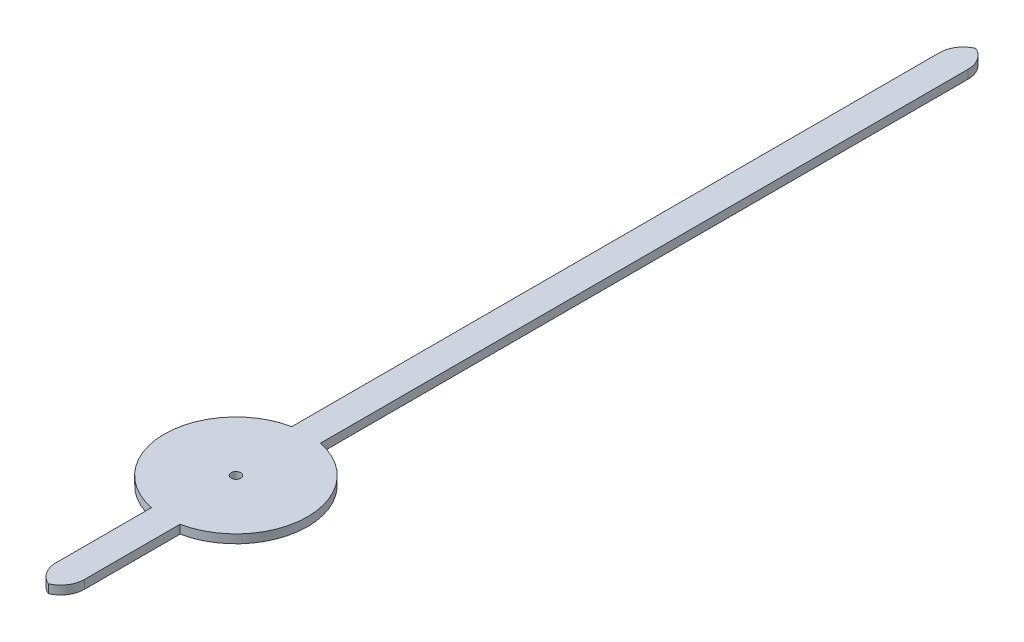
from build123d import *

# Parameters (mm, degrees)
SKETCH1_R           = 0.1
BOSS_EXTRUDE1_DEPTH = 0.18
FILLET2_R           = 0.5


with BuildPart() as part:
    # Sketch1 → Boss-Extrude1 (new body)
    with BuildSketch(Plane(origin=(0, 0, 0), x_dir=(1, 0, 0), z_dir=(0, 1, 0))):
        with BuildLine():
            Line((-0.3, -3.969693846), (-0.3, -1.469693846))
            ThreePointArc((-0.3, -1.469693846), (-1.5, 0), (-0.3, 1.469693846))
            Line((-0.3, 1.469693846), (-0.3, 15.530306154))
            Line((-0.3, 15.530306154), (0.3, 15.530306154))
            Line((0.3, 15.530306154), (0.3, 1.469693846))
            ThreePointArc((0.3, 1.469693846), (1.5, 0), (0.3, -1.469693846))
            Line((0.3, -1.469693846), (0.3, -3.969693846))
            Line((0.3, -3.969693846), (-0.3, -3.969693846))
        make_face()
        with Locations(Location((0, 0, 0), (0, 0, 270))):
            Circle(SKETCH1_R, mode=Mode.SUBTRACT)
    extrude(amount=BOSS_EXTRUDE1_DEPTH)

    # Fillet2
    # the kernel refuses this fillet: 0.5 mm, written as the material it takes off along each edge
    with BuildSketch(Plane(origin=(-0.3, -1.25, -15.530306154), x_dir=(0, 0, 1), z_dir=(0, 1, 0)), Plane(origin=(0.3, -1.25, -15.530306154), x_dir=(-1, 0, 0), z_dir=(0, 1, 0)), Plane(origin=(-0.3, -1.25, 3.969693846), x_dir=(1, 0, 0), z_dir=(0, 1, 0)), Plane(origin=(0.3, -1.25, 3.969693846), x_dir=(0, 0, -1), z_dir=(0, 1, 0))) as fillet2_piece_1:
        with BuildLine():
            CenterArc((FILLET2_R, FILLET2_R), FILLET2_R, 180, 90)
            Line((0, FILLET2_R), (0, 0))
            Line((0, 0), (FILLET2_R, 0))
        make_face()
    extrude(amount=2.68, mode=Mode.SUBTRACT)


solid = part.part
